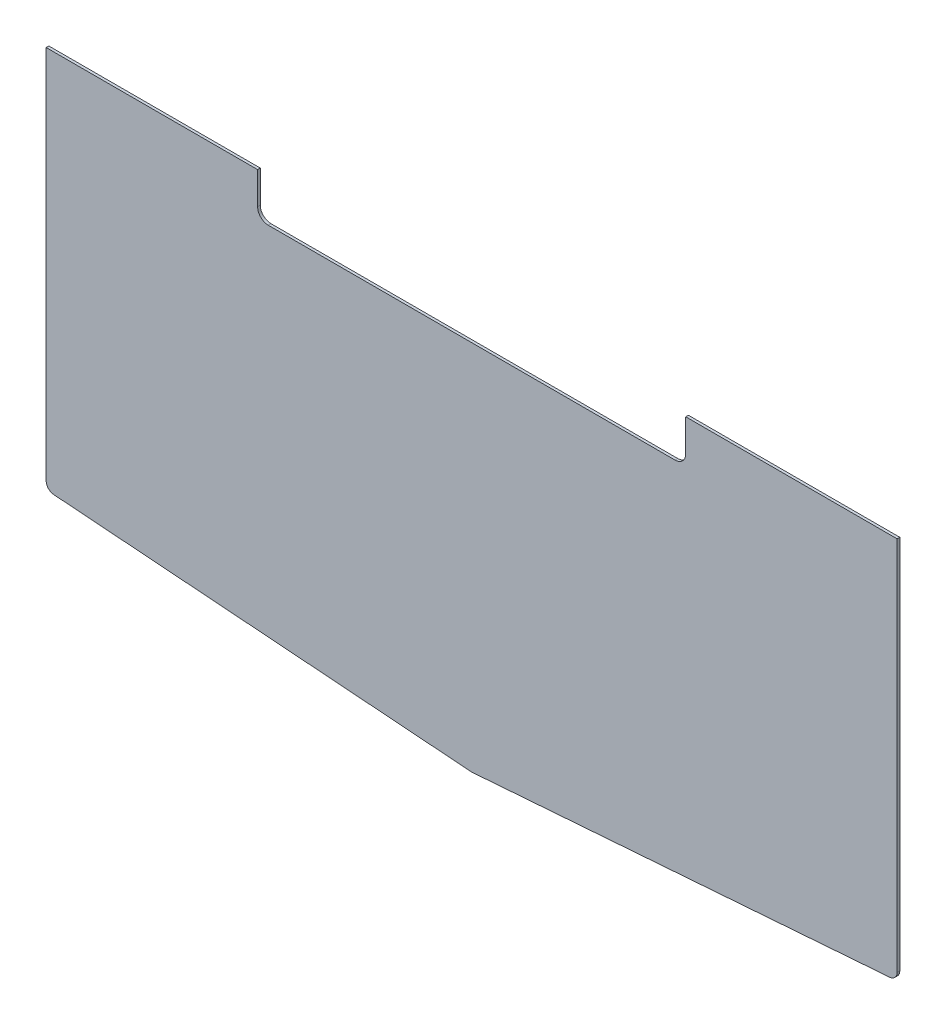
from build123d import *

# Parameters (mm, degrees)
EXTRUDE1_DEPTH     = 1.5875
SKETCH2_W          = 254
SKETCH2_H          = 25.4
CUT_EXTRUDE1_DEPTH = 416.627995102
FILLET1_R          = 6.35


with BuildPart() as part:
    # Sketch1 → Extrude1 (new body)
    with BuildSketch(Plane.XY):
        with BuildLine():
            Line((-252.4125, 107.491584331), (-252.4125, 330.2))
            Line((-252.4125, 330.2), (252.4125, 330.2))
            Line((252.4125, 330.2), (252.4125, 107.491584331))
            ThreePointArc((252.4125, 107.491584331), (251.141256754, 104.252366443), (248.006187129, 102.742422617))
            Line((248.006187129, 102.742422617), (0.356187129, 84.168672617))
            ThreePointArc((0.356187129, 84.168672617), (0, 84.155334331), (-0.356187129, 84.168672617))
            Line((-0.356187129, 84.168672617), (-248.006187129, 102.742422617))
            ThreePointArc((-248.006187129, 102.742422617), (-251.141256754, 104.252366443), (-252.4125, 107.491584331))
        make_face()
    extrude(amount=EXTRUDE1_DEPTH)

    # Sketch2 → Cut-Extrude1 (cut, through all)
    with BuildSketch(Plane.XY.offset(1.5875)):
        with Locations((0, 317.5)):
            Rectangle(SKETCH2_W, SKETCH2_H)
    extrude(amount=-CUT_EXTRUDE1_DEPTH, mode=Mode.SUBTRACT)

    # Fillet1
    fillet1_edges = [part.edges().sort_by_distance(p)[0] for p in [
        (127, 304.8, 0.79375),
        (-127, 304.8, 0.79375),
    ]]
    fillet(fillet1_edges, radius=FILLET1_R)


solid = part.part
